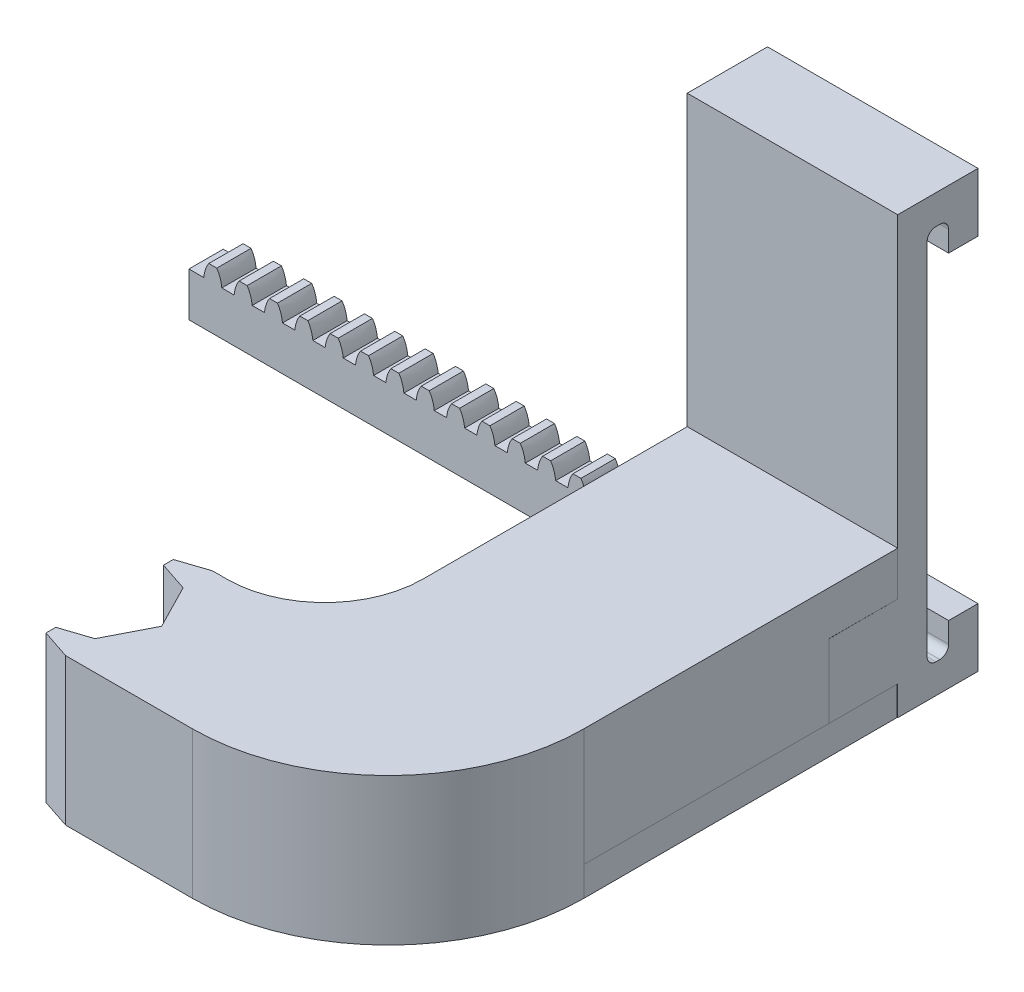
from build123d import *

# Parameters (mm, degrees)
AUFSATZ_LINEAR_AUSTRAGEN1_DEPTH = 3
AUFSATZ_LINEAR_AUSTRAGEN2_DEPTH = 3
AUFSATZ_LINEAR_AUSTRAGEN3_DEPTH = 21.498963073
AUFSATZ_LINEAR_AUSTRAGEN4_DEPTH = 7
AUFSATZ_LINEAR_AUSTRAGEN5_DEPTH = 7
LINEARES_START                  = -28.634680498
LINEARES_MUSTER1_DEPTH          = 7
SKIZZE6_W                       = 21.498963074
SKIZZE6_H                       = 4
AUFSATZ_LINEAR_AUSTRAGEN6_DEPTH = 7
VERRUNDUNG1_R                   = 20
VERRUNDUNG2_R                   = 10
SCHNITT_LINEAR_START            = -43.900474
SKIZZE7_W                       = 3.5
SKIZZE7_H                       = 5
SCHNITT_LINEAR_AUSTRAGEN1_DEPTH = 43.900474
SKIZZE8_W                       = 3.5
SKIZZE8_H                       = 1
AUFSATZ_LINEAR_AUSTRAGEN7_DEPTH = 43.900474054
AUFSATZ_LINEAR_START            = 12
AUFSATZ_LINEAR_AUSTRAGEN8_DEPTH = 12
SCHNITT_LINEAR_AUSTRAGEN2_DEPTH = 22.95


# Read off the part's stored shape, not the designer's step: Lineares Muster1
with BuildPart() as part:
    # Skizze1 → Aufsatz-Linear austragen1 (new body)
    with BuildSketch(Plane(origin=(0, 0, 0), x_dir=(1, 0, 0), z_dir=(0, 1, 0))):
        Polygon((30.639792174, -23.365319502), (30.639792174, 31.634680498), (9.170980072, 31.634680498), (9.170980072, -8.365424281), (-2.304142194, -8.365424281), (-5.310616073, -9.365403325), (-5.310616073, -10.365403325), (-2.304142194, -11.365403325), (-5.310616073, -12.36538237), (-5.310616073, -13.36538237), (-2.304142194, -14.36538237), (-5.310616073, -15.365361414), (-5.310616073, -16.365361414), (-2.304142194, -17.365361414), (-5.310616073, -18.365340458), (-5.310616073, -19.365340458), (-2.304142194, -20.365340458), (-5.310616073, -21.365319502), (-5.310616073, -22.365319502), (-2.304142194, -23.365319502), align=None)
    extrude(amount=AUFSATZ_LINEAR_AUSTRAGEN1_DEPTH)

    # Skizze2 → Aufsatz-Linear austragen2 (add)
    with BuildSketch(Plane(origin=(0, 0, -31.634680498), x_dir=(-1, 0, 0), z_dir=(0, 0, -1))):
        Polygon((-30.689391658, 7), (-30.689391658, 44.5), (-9.190428584, 44.5), (-9.190428584, 17), (-9.190428584, 0), (-30.689391658, 0), align=None)
    extrude(amount=-AUFSATZ_LINEAR_AUSTRAGEN2_DEPTH)

    # Skizze3 → Aufsatz-Linear austragen3 (add)
    with BuildSketch(Plane(origin=(30.689391658, 0, 0), x_dir=(0, 0, -1), z_dir=(1, 0, 0))):
        with BuildLine():
            Line((36.834680498, 44.5), (36.834680498, 41.5))
            Line((36.834680498, 41.5), (36.834680498, 38.5))
            Line((36.834680498, 38.5), (33.834680498, 38.5))
            Line((33.834680498, 38.5), (33.834680498, 40.6))
            ThreePointArc((33.834680498, 40.6), (33.571076601, 41.236396103), (32.934680498, 41.5))
            Line((32.934680498, 41.5), (32.534680498, 41.5))
            ThreePointArc((32.534680498, 41.5), (31.898284395, 41.236396103), (31.634680498, 40.6))
            Line((31.634680498, 40.6), (31.634680498, 38.5))
            Line((31.634680498, 38.5), (28.634680498, 38.5))
            Line((28.634680498, 38.5), (28.634680498, 44.5))
            Line((28.634680498, 44.5), (36.834680498, 44.5))
        make_face()
        with BuildLine():
            Line((36.834680498, 0), (36.834680498, 3))
            Line((36.834680498, 3), (36.834680498, 6))
            Line((36.834680498, 6), (33.834680498, 6))
            Line((33.834680498, 6), (33.834680498, 3.9))
            ThreePointArc((33.834680498, 3.9), (33.571076601, 3.263603897), (32.934680498, 3))
            Line((32.934680498, 3), (32.534680498, 3))
            ThreePointArc((32.534680498, 3), (31.898284395, 3.263603897), (31.634680498, 3.9))
            Line((31.634680498, 3.9), (31.634680498, 6))
            Line((31.634680498, 6), (28.634680498, 6))
            Line((28.634680498, 6), (28.634680498, 0))
            Line((28.634680498, 0), (36.834680498, 0))
        make_face()
    extrude(amount=-AUFSATZ_LINEAR_AUSTRAGEN3_DEPTH)

    # Skizze4 → Aufsatz-Linear austragen4 (add)
    with BuildSketch(Plane.XY.offset(-28.634680498)):
        Polygon((9.220579556, 10.5), (-34.710045469, 10.5), (-34.710045469, 7), (9.220579556, 7), (11.703115994, 7), (30.689391658, 7), (30.689391658, 10.5), (11.703115994, 10.5), align=None)
    extrude(amount=AUFSATZ_LINEAR_AUSTRAGEN4_DEPTH)

    # Skizze5 → Aufsatz-Linear austragen5 (add)
    with BuildSketch(Plane.XY.offset(-21.634680498)):
        with BuildLine():
            Line((7.105206323, 10.5), (8.947130309, 10.5))
            add(Edge.make_bspline(
                [(8.433908462, 12), (8.851074878, 11.391461617), (8.947130309, 10.5)],
                knots=[0, 0, 0, 1, 1, 1], degree=2))
            Line((8.433908462, 12), (7.61842817, 12))
            add(Edge.make_bspline(
                [(7.61842817, 12), (7.201261753, 11.391461617), (7.105206323, 10.5)],
                knots=[0, 0, 0, 1, 1, 1], degree=2))
        make_face()
    extrude(amount=-AUFSATZ_LINEAR_AUSTRAGEN5_DEPTH)

    # Lineares Muster1 outline → Lineares Muster1 (add)
    with BuildSketch(Plane.XY.offset(LINEARES_START)):
        with BuildLine():
            add(Edge.make_bspline(
                [(29.31842817, 12), (28.901261753, 11.391461617), (28.805206323, 10.5)],
                knots=[0, 0, 0, 1, 1, 1], degree=2))
            Line((28.805206323, 10.5), (30.647130308, 10.5))
            add(Edge.make_bspline(
                [(30.133908462, 12), (30.551074878, 11.391461617), (30.647130308, 10.5)],
                knots=[0, 0, 0, 1, 1, 1], degree=2))
            Line((30.133908462, 12), (29.31842817, 12))
        make_face()
        with BuildLine():
            add(Edge.make_bspline(
                [(26.21842817, 12), (25.801261753, 11.391461617), (25.705206323, 10.5)],
                knots=[0, 0, 0, 1, 1, 1], degree=2))
            Line((25.705206323, 10.5), (27.547130309, 10.5))
            add(Edge.make_bspline(
                [(27.033908462, 12), (27.451074878, 11.391461617), (27.547130309, 10.5)],
                knots=[0, 0, 0, 1, 1, 1], degree=2))
            Line((27.033908462, 12), (26.21842817, 12))
        make_face()
        with BuildLine():
            add(Edge.make_bspline(
                [(23.11842817, 12), (22.701261753, 11.391461617), (22.605206323, 10.5)],
                knots=[0, 0, 0, 1, 1, 1], degree=2))
            Line((22.605206323, 10.5), (24.447130309, 10.5))
            add(Edge.make_bspline(
                [(23.933908462, 12), (24.351074878, 11.391461617), (24.447130309, 10.5)],
                knots=[0, 0, 0, 1, 1, 1], degree=2))
            Line((23.933908462, 12), (23.11842817, 12))
        make_face()
        with BuildLine():
            add(Edge.make_bspline(
                [(20.01842817, 12), (19.601261753, 11.391461617), (19.505206323, 10.5)],
                knots=[0, 0, 0, 1, 1, 1], degree=2))
            Line((19.505206323, 10.5), (21.347130308, 10.5))
            add(Edge.make_bspline(
                [(20.833908462, 12), (21.251074878, 11.391461617), (21.347130308, 10.5)],
                knots=[0, 0, 0, 1, 1, 1], degree=2))
            Line((20.833908462, 12), (20.01842817, 12))
        make_face()
        with BuildLine():
            add(Edge.make_bspline(
                [(16.91842817, 12), (16.501261753, 11.391461617), (16.405206323, 10.5)],
                knots=[0, 0, 0, 1, 1, 1], degree=2))
            Line((16.405206323, 10.5), (18.247130309, 10.5))
            add(Edge.make_bspline(
                [(17.733908462, 12), (18.151074878, 11.391461617), (18.247130309, 10.5)],
                knots=[0, 0, 0, 1, 1, 1], degree=2))
            Line((17.733908462, 12), (16.91842817, 12))
        make_face()
        with BuildLine():
            add(Edge.make_bspline(
                [(13.81842817, 12), (13.401261753, 11.391461617), (13.305206323, 10.5)],
                knots=[0, 0, 0, 1, 1, 1], degree=2))
            Line((13.305206323, 10.5), (15.147130308, 10.5))
            add(Edge.make_bspline(
                [(14.633908462, 12), (15.051074878, 11.391461617), (15.147130308, 10.5)],
                knots=[0, 0, 0, 1, 1, 1], degree=2))
            Line((14.633908462, 12), (13.81842817, 12))
        make_face()
        with BuildLine():
            add(Edge.make_bspline(
                [(11.533908462, 12), (11.951074878, 11.391461617), (12.047130308, 10.5)],
                knots=[0, 0, 0, 1, 1, 1], degree=2))
            Line((11.533908462, 12), (10.71842817, 12))
            add(Edge.make_bspline(
                [(10.71842817, 12), (10.301261753, 11.391461617), (10.205206323, 10.5)],
                knots=[0, 0, 0, 1, 1, 1], degree=2))
            Line((10.205206323, 10.5), (12.047130308, 10.5))
        make_face()
        with BuildLine():
            Line((-33.194793677, 10.5), (-31.352869692, 10.5))
            add(Edge.make_bspline(
                [(-31.866091538, 12), (-31.448925122, 11.391461617), (-31.352869692, 10.5)],
                knots=[0, 0, 0, 1, 1, 1], degree=2))
            Line((-31.866091538, 12), (-32.68157183, 12))
            add(Edge.make_bspline(
                [(-32.68157183, 12), (-33.098738247, 11.391461617), (-33.194793677, 10.5)],
                knots=[0, 0, 0, 1, 1, 1], degree=2))
        make_face()
        with BuildLine():
            Line((-30.094793677, 10.5), (-28.252869691, 10.5))
            add(Edge.make_bspline(
                [(-28.766091538, 12), (-28.348925122, 11.391461617), (-28.252869691, 10.5)],
                knots=[0, 0, 0, 1, 1, 1], degree=2))
            Line((-28.766091538, 12), (-29.58157183, 12))
            add(Edge.make_bspline(
                [(-29.58157183, 12), (-29.998738247, 11.391461617), (-30.094793677, 10.5)],
                knots=[0, 0, 0, 1, 1, 1], degree=2))
        make_face()
        with BuildLine():
            Line((-26.994793677, 10.5), (-25.152869692, 10.5))
            add(Edge.make_bspline(
                [(-25.666091538, 12), (-25.248925122, 11.391461617), (-25.152869692, 10.5)],
                knots=[0, 0, 0, 1, 1, 1], degree=2))
            Line((-25.666091538, 12), (-26.48157183, 12))
            add(Edge.make_bspline(
                [(-26.48157183, 12), (-26.898738247, 11.391461617), (-26.994793677, 10.5)],
                knots=[0, 0, 0, 1, 1, 1], degree=2))
        make_face()
        with BuildLine():
            Line((-23.894793677, 10.5), (-22.052869691, 10.5))
            add(Edge.make_bspline(
                [(-22.566091538, 12), (-22.148925122, 11.391461617), (-22.052869691, 10.5)],
                knots=[0, 0, 0, 1, 1, 1], degree=2))
            Line((-22.566091538, 12), (-23.38157183, 12))
            add(Edge.make_bspline(
                [(-23.38157183, 12), (-23.798738247, 11.391461617), (-23.894793677, 10.5)],
                knots=[0, 0, 0, 1, 1, 1], degree=2))
        make_face()
        with BuildLine():
            Line((-20.794793677, 10.5), (-18.952869691, 10.5))
            add(Edge.make_bspline(
                [(-19.466091538, 12), (-19.048925122, 11.391461617), (-18.952869691, 10.5)],
                knots=[0, 0, 0, 1, 1, 1], degree=2))
            Line((-19.466091538, 12), (-20.28157183, 12))
            add(Edge.make_bspline(
                [(-20.28157183, 12), (-20.698738247, 11.391461617), (-20.794793677, 10.5)],
                knots=[0, 0, 0, 1, 1, 1], degree=2))
        make_face()
        with BuildLine():
            Line((-17.694793677, 10.5), (-15.852869692, 10.5))
            add(Edge.make_bspline(
                [(-16.366091538, 12), (-15.948925122, 11.391461617), (-15.852869692, 10.5)],
                knots=[0, 0, 0, 1, 1, 1], degree=2))
            Line((-16.366091538, 12), (-17.18157183, 12))
            add(Edge.make_bspline(
                [(-17.18157183, 12), (-17.598738247, 11.391461617), (-17.694793677, 10.5)],
                knots=[0, 0, 0, 1, 1, 1], degree=2))
        make_face()
        with BuildLine():
            Line((-14.594793677, 10.5), (-12.752869692, 10.5))
            add(Edge.make_bspline(
                [(-13.266091538, 12), (-12.848925122, 11.391461617), (-12.752869692, 10.5)],
                knots=[0, 0, 0, 1, 1, 1], degree=2))
            Line((-13.266091538, 12), (-14.08157183, 12))
            add(Edge.make_bspline(
                [(-14.08157183, 12), (-14.498738247, 11.391461617), (-14.594793677, 10.5)],
                knots=[0, 0, 0, 1, 1, 1], degree=2))
        make_face()
        with BuildLine():
            Line((-11.494793677, 10.5), (-9.652869691, 10.5))
            add(Edge.make_bspline(
                [(-10.166091538, 12), (-9.748925122, 11.391461617), (-9.652869691, 10.5)],
                knots=[0, 0, 0, 1, 1, 1], degree=2))
            Line((-10.166091538, 12), (-10.98157183, 12))
            add(Edge.make_bspline(
                [(-10.98157183, 12), (-11.398738247, 11.391461617), (-11.494793677, 10.5)],
                knots=[0, 0, 0, 1, 1, 1], degree=2))
        make_face()
        with BuildLine():
            Line((-8.394793677, 10.5), (-6.552869691, 10.5))
            add(Edge.make_bspline(
                [(-7.066091538, 12), (-6.648925122, 11.391461617), (-6.552869691, 10.5)],
                knots=[0, 0, 0, 1, 1, 1], degree=2))
            Line((-7.066091538, 12), (-7.88157183, 12))
            add(Edge.make_bspline(
                [(-7.88157183, 12), (-8.298738247, 11.391461617), (-8.394793677, 10.5)],
                knots=[0, 0, 0, 1, 1, 1], degree=2))
        make_face()
        with BuildLine():
            Line((-5.294793677, 10.5), (-3.452869691, 10.5))
            add(Edge.make_bspline(
                [(-3.966091538, 12), (-3.548925122, 11.391461617), (-3.452869691, 10.5)],
                knots=[0, 0, 0, 1, 1, 1], degree=2))
            Line((-3.966091538, 12), (-4.78157183, 12))
            add(Edge.make_bspline(
                [(-4.78157183, 12), (-5.198738247, 11.391461617), (-5.294793677, 10.5)],
                knots=[0, 0, 0, 1, 1, 1], degree=2))
        make_face()
        with BuildLine():
            Line((-2.194793677, 10.5), (-0.352869691, 10.5))
            add(Edge.make_bspline(
                [(-0.866091538, 12), (-0.448925122, 11.391461617), (-0.352869691, 10.5)],
                knots=[0, 0, 0, 1, 1, 1], degree=2))
            Line((-0.866091538, 12), (-1.68157183, 12))
            add(Edge.make_bspline(
                [(-1.68157183, 12), (-2.098738247, 11.391461617), (-2.194793677, 10.5)],
                knots=[0, 0, 0, 1, 1, 1], degree=2))
        make_face()
        with BuildLine():
            Line((0.905206323, 10.5), (2.747130309, 10.5))
            add(Edge.make_bspline(
                [(2.233908462, 12), (2.651074878, 11.391461617), (2.747130309, 10.5)],
                knots=[0, 0, 0, 1, 1, 1], degree=2))
            Line((2.233908462, 12), (1.41842817, 12))
            add(Edge.make_bspline(
                [(1.41842817, 12), (1.001261753, 11.391461617), (0.905206323, 10.5)],
                knots=[0, 0, 0, 1, 1, 1], degree=2))
        make_face()
        with BuildLine():
            add(Edge.make_bspline(
                [(5.333908462, 12), (5.751074878, 11.391461617), (5.847130309, 10.5)],
                knots=[0, 0, 0, 1, 1, 1], degree=2))
            Line((5.333908462, 12), (4.51842817, 12))
            add(Edge.make_bspline(
                [(4.51842817, 12), (4.101261753, 11.391461617), (4.005206323, 10.5)],
                knots=[0, 0, 0, 1, 1, 1], degree=2))
            Line((4.005206323, 10.5), (5.847130309, 10.5))
        make_face()
    extrude(amount=LINEARES_MUSTER1_DEPTH)

    # Skizze6 → Aufsatz-Linear austragen6 (add)
    with BuildSketch(Plane.XY.offset(-21.634680498)):
        with Locations((19.939910121, 5)):
            Rectangle(SKIZZE6_W, SKIZZE6_H)
    extrude(amount=-AUFSATZ_LINEAR_AUSTRAGEN6_DEPTH)

    # Verrundung1
    verrundung1_edges = [part.edges().sort_by_distance(p)[0] for p in [
        (30.639792174, 1.5, 23.365319502),
    ]]
    fillet(verrundung1_edges, radius=VERRUNDUNG1_R)

    # Verrundung2
    verrundung2_edges = [part.edges().sort_by_distance(p)[0] for p in [
        (9.170980072, 1.5, 8.365424281),
    ]]
    fillet(verrundung2_edges, radius=VERRUNDUNG2_R)

    # Skizze7 → Schnitt-Linear austragen1 (cut)
    with BuildSketch(Plane.ZY.offset(34.710045469).offset(SCHNITT_LINEAR_START)):
        with Locations((-26.884680498, 9.5)):
            Rectangle(SKIZZE7_W, SKIZZE7_H)
    extrude(amount=SCHNITT_LINEAR_AUSTRAGEN1_DEPTH, mode=Mode.SUBTRACT)

    # Skizze8 → Aufsatz-Linear austragen7 (add)
    with BuildSketch(Plane.ZY.offset(34.710045469)):
        with Locations((-23.384680498, 6.5)):
            Rectangle(SKIZZE8_W, SKIZZE8_H)
    extrude(amount=-AUFSATZ_LINEAR_AUSTRAGEN7_DEPTH)

    # Skizze9 → Aufsatz-Linear austragen8 (add)
    with BuildSketch(Plane(origin=(0, 3, 0), x_dir=(1, 0, 0), z_dir=(0, 1, 0)).offset(AUFSATZ_LINEAR_START)):
        with BuildLine():
            Line((9.170980072, 1.634575719), (9.190428584, 28.634680498))
            Line((9.190428584, 28.634680498), (30.689391658, 28.634680498))
            Line((30.689391658, 28.634680498), (30.639792174, -3.365319502))
            ThreePointArc((30.639792174, -3.365319502), (24.781927797, -17.507455126), (10.639792174, -23.365319502))
            Line((10.639792174, -23.365319502), (-2.304142194, -23.365319502))
            Line((-2.304142194, -23.365319502), (-5.310616073, -22.365319502))
            Line((-5.310616073, -22.365319502), (-5.310616073, -21.365319502))
            Line((-5.310616073, -21.365319502), (-2.304142194, -20.365340458))
            Line((-2.304142194, -20.365340458), (-5.310616073, -19.365340458))
            Line((-5.310616073, -19.365340458), (-5.310616073, -18.365340458))
            Line((-5.310616073, -18.365340458), (-2.304142194, -17.365361414))
            Line((-2.304142194, -17.365361414), (-5.310616073, -16.365361414))
            Line((-5.310616073, -16.365361414), (-5.310616073, -15.365361414))
            Line((-5.310616073, -15.365361414), (-2.304142194, -14.36538237))
            Line((-2.304142194, -14.36538237), (-5.310616073, -13.36538237))
            Line((-5.310616073, -13.36538237), (-5.310616073, -12.36538237))
            Line((-5.310616073, -12.36538237), (-2.304142194, -11.365403325))
            Line((-2.304142194, -11.365403325), (-5.310616073, -10.365403325))
            Line((-5.310616073, -10.365403325), (-5.310616073, -9.365403325))
            Line((-5.310616073, -9.365403325), (-2.304142194, -8.365424281))
            Line((-2.304142194, -8.365424281), (-0.829019928, -8.365424281))
            ThreePointArc((-0.829019928, -8.365424281), (6.242047884, -5.436492093), (9.170980072, 1.634575719))
        make_face()
    extrude(amount=-AUFSATZ_LINEAR_AUSTRAGEN8_DEPTH)

    # Skizze10 → Schnitt-Linear austragen2 (cut)
    with BuildSketch(Plane(origin=(0, 15, 0), x_dir=(1, 0, 0), z_dir=(0, 1, 0))):
        Polygon((-2.304142194, -11.365403325), (0, -15.865361414), (-2.304142194, -20.365340458), (-8.151756162, -20.365340458), (-8.151756162, -11.365403325), align=None)
    extrude(amount=-SCHNITT_LINEAR_AUSTRAGEN2_DEPTH, mode=Mode.SUBTRACT)


solid = part.part
